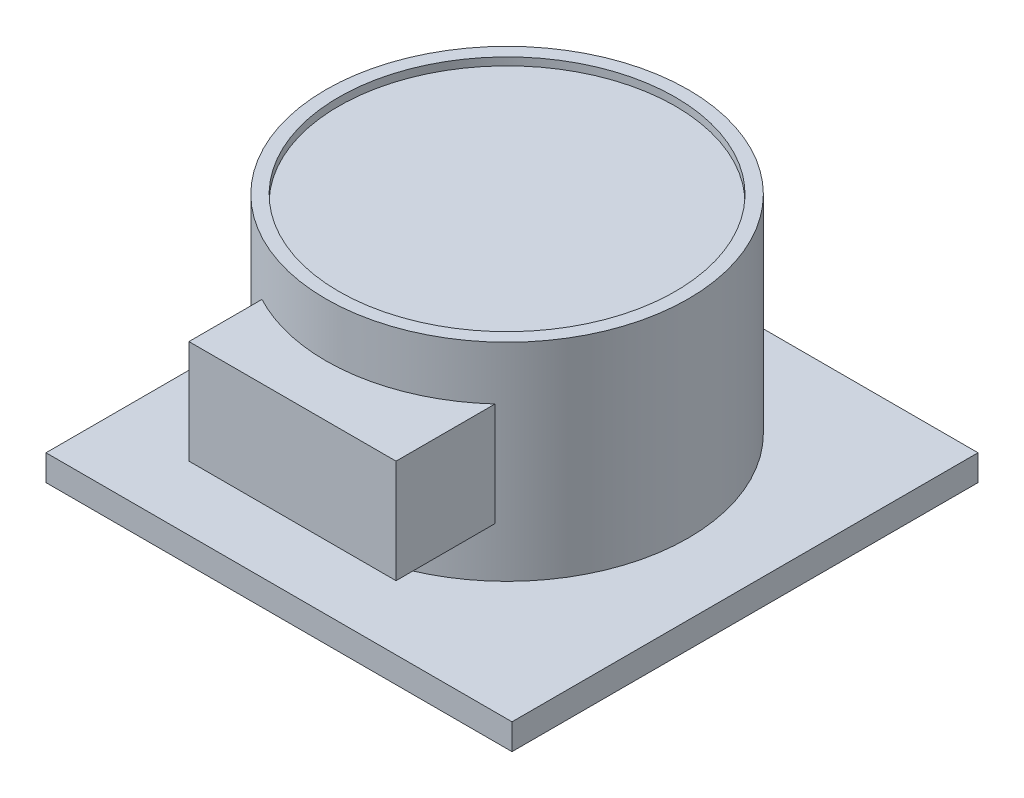
from build123d import *

# Parameters (mm, degrees)
SKETCH1_W           = 180
SKETCH1_H           = 180
BOSS_EXTRUDE1_DEPTH = 10
SKETCH2_R           = 70
BOSS_EXTRUDE2_DEPTH = 80
SKETCH3_W           = 80
SKETCH3_H           = 40
BOSS_EXTRUDE3_DEPTH = 90
SKETCH4_R           = 65
CUT_EXTRUDE1_DEPTH  = 3


with BuildPart() as part:
    # Sketch1 → Boss-Extrude1 (new body)
    with BuildSketch(Plane(origin=(0, 0, 0), x_dir=(1, 0, 0), z_dir=(0, 1, 0))):
        with Locations((-49.591836735, -5.510204082)):
            Rectangle(SKETCH1_W, SKETCH1_H)
    extrude(amount=BOSS_EXTRUDE1_DEPTH)

    # Sketch2 → Boss-Extrude2 (add)
    with BuildSketch(Plane(origin=(0, 10, 0), x_dir=(1, 0, 0), z_dir=(0, 1, 0))):
        with Locations((-57.006666854, 0)):
            Circle(SKETCH2_R)
    extrude(amount=BOSS_EXTRUDE2_DEPTH)

    # Sketch3 → Boss-Extrude3 (add)
    with BuildSketch(Plane.XY):
        with Locations((-49.893940427, 49.288531055)):
            Rectangle(SKETCH3_W, SKETCH3_H)
    extrude(amount=BOSS_EXTRUDE3_DEPTH)

    # Sketch4 → Cut-Extrude1 (cut)
    with BuildSketch(Plane(origin=(0, 90, 0), x_dir=(1, 0, 0), z_dir=(0, 1, 0))):
        with Locations((-57.006666854, 0)):
            Circle(SKETCH4_R)
    extrude(amount=-CUT_EXTRUDE1_DEPTH, mode=Mode.SUBTRACT)


solid = part.part
